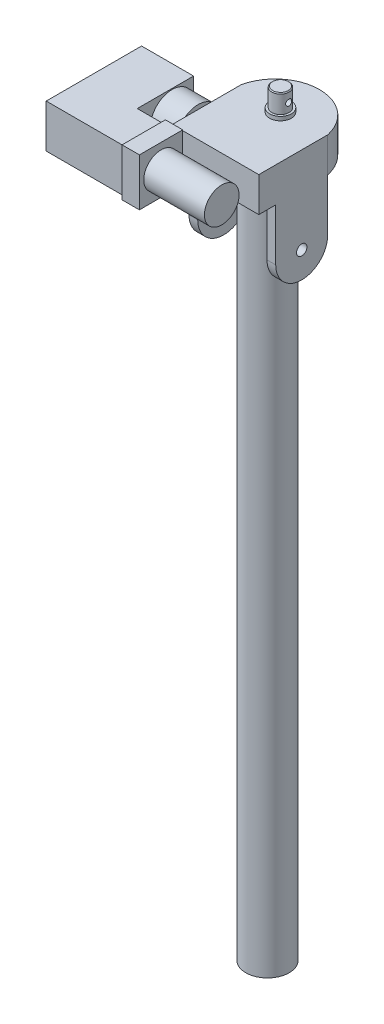
from build123d import *

# Parameters (mm, degrees)
SALIENTE_EXTRUIR2_DEPTH    = 40
CROQUIS2_R                 = 12.5
SALIENTE_EXTRUIR3_DEPTH    = 4.5
CROQUIS3_R                 = 10
SALIENTE_EXTRUIR4_DEPTH    = 21.5
CORTAR_EXTRUIR1_DEPTH      = 21.5
CORTAR_EXTRUIR1_DEPTH_BACK = 21.5
CROQUIS4_R                 = 3.5
CHAFL_N1_SIZE              = 1
CROQUIS5_R                 = 25
SALIENTE_EXTRUIR5_DEPTH    = 30
CROQUIS6_W                 = 110
CROQUIS6_H                 = 50
SALIENTE_EXTRUIR6_DEPTH    = 60
CROQUIS10_W                = 45
CROQUIS10_H                = 50
SALIENTE_EXTRUIR7_DEPTH    = 30
CROQUIS12_W                = 50
CROQUIS12_H                = 55
SALIENTE_EXTRUIR8_DEPTH    = 20
CROQUIS13_R                = 20
SALIENTE_EXTRUIR9_DEPTH    = 70
CROQUIS14_W                = 10
CROQUIS14_H                = 60
SALIENTE_EXTRUIR10_DEPTH   = 90
CROQUIS15_R                = 6
CORTAR_EXTRUIR4_DEPTH      = 136
CROQUIS16_R                = 25
SALIENTE_EXTRUIR11_DEPTH   = 800


with BuildPart() as part:
    # Croquis1 → Saliente-Extruir2 (new body)
    with BuildSketch(Plane(origin=(0, 0, 0), x_dir=(1, 0, 0), z_dir=(0, 1, 0))):
        with BuildLine():
            Line((-50, 19.52562419), (-50, -60))
            Line((-50, -60), (50, -60))
            Line((50, -60), (50, 19.52562419))
            ThreePointArc((50, 19.52562419), (0, 60), (-50, 19.52562419))
        make_face()
    extrude(amount=SALIENTE_EXTRUIR2_DEPTH)

    # Croquis2 → Saliente-Extruir3 (add)
    with BuildSketch(Plane(origin=(0, 40, 0), x_dir=(1, 0, 0), z_dir=(0, 1, 0))):
        with Locations((0, 15)):
            Circle(CROQUIS2_R)
    extrude(amount=SALIENTE_EXTRUIR3_DEPTH)

    # Croquis3 → Saliente-Extruir4 (add)
    with BuildSketch(Plane(origin=(0, 44.5, 0), x_dir=(1, 0, 0), z_dir=(0, 1, 0))):
        with Locations((0, 15)):
            Circle(CROQUIS3_R)
    extrude(amount=SALIENTE_EXTRUIR4_DEPTH)

    # Croquis4 → Cortar-Extruir1 (cut, two sides: drawn at the far end of the back side and taken through both)
    with BuildSketch(Plane(origin=(0, 0, 0), x_dir=(0, 0, -1), z_dir=(1, 0, 0)).offset(-CORTAR_EXTRUIR1_DEPTH_BACK)):
        with Locations((15, 54.5)):
            Circle(CROQUIS4_R)
    extrude(amount=CORTAR_EXTRUIR1_DEPTH + CORTAR_EXTRUIR1_DEPTH_BACK, mode=Mode.SUBTRACT)

    # Chaflán1
    chafl_n1_edges = [part.edges().sort_by_distance(p)[0] for p in [
        (-10, 66, -15),
    ]]
    chamfer(chafl_n1_edges, length=CHAFL_N1_SIZE)

    # Croquis5 → Saliente-Extruir5 (add)
    with BuildSketch(Plane.ZY.offset(50)):
        with Locations((30, 20)):
            Circle(CROQUIS5_R)
    extrude(amount=SALIENTE_EXTRUIR5_DEPTH)

    # Croquis6 → Saliente-Extruir6 (add)
    with BuildSketch(Plane.ZY.offset(80)):
        with Locations((60.2509382, 21.110140405)):
            Rectangle(CROQUIS6_W, CROQUIS6_H)
    extrude(amount=SALIENTE_EXTRUIR6_DEPTH)

    # Croquis10 → Saliente-Extruir7 (add)
    with BuildSketch(Plane(origin=(-80, 0, 0), x_dir=(0, 0, -1), z_dir=(1, 0, 0))):
        with Locations((-92.7509382, 21.110140405)):
            Rectangle(CROQUIS10_W, CROQUIS10_H)
    extrude(amount=SALIENTE_EXTRUIR7_DEPTH)

    # Croquis12 → Saliente-Extruir8 (add)
    with BuildSketch(Plane(origin=(-50, 0, 0), x_dir=(0, 0, -1), z_dir=(1, 0, 0))):
        with Locations((-92.7509382, 21.110140405)):
            Rectangle(CROQUIS12_W, CROQUIS12_H)
    extrude(amount=SALIENTE_EXTRUIR8_DEPTH)

    # Croquis13 → Saliente-Extruir9 (add)
    with BuildSketch(Plane(origin=(-30, 0, 0), x_dir=(0, 0, -1), z_dir=(1, 0, 0))):
        with Locations((-92.7509382, 21.110140405)):
            Circle(CROQUIS13_R)
    extrude(amount=SALIENTE_EXTRUIR9_DEPTH)

    # Croquis14 → Saliente-Extruir10 (add)
    with BuildSketch(Plane.XZ):
        with Locations((-45, 10.47437581)):
            Rectangle(CROQUIS14_W, CROQUIS14_H)
    saliente_extruir10 = extrude(amount=SALIENTE_EXTRUIR10_DEPTH)

    # Simetría1: Saliente-Extruir10 across plane
    add(saliente_extruir10.mirror(Plane(origin=(0, 0, 0), x_dir=(0, 0, 1), z_dir=(1, 0, 0))))

    # Croquis15 → Cortar-Extruir4 (cut)
    with BuildSketch(Plane.ZY.offset(50)):
        with BuildLine():
            Line((-19.52562419, -90), (10.474375689, -90))
            ThreePointArc((10.474375689, -90), (-10.738827668, -81.213203393), (-19.52562419, -60))
            Line((-19.52562419, -60), (-19.52562419, -90))
        make_face()
        with BuildLine():
            Line((40.47437581, -90), (40.47437581, -60))
            ThreePointArc((40.47437581, -60), (31.687579203, -81.213203478), (10.474375689, -90))
            Line((10.474375689, -90), (40.47437581, -90))
        make_face()
        with Locations((10.47437581, -60)):
            Circle(CROQUIS15_R)
    extrude(amount=-CORTAR_EXTRUIR4_DEPTH, mode=Mode.SUBTRACT)

    # Croquis16 → Saliente-Extruir11 (add)
    with BuildSketch(Plane(origin=(0, 0, 0), x_dir=(-1, 0, 0), z_dir=(0, -1, 0))):
        Circle(CROQUIS16_R)
    extrude(amount=SALIENTE_EXTRUIR11_DEPTH)


solid = part.part
